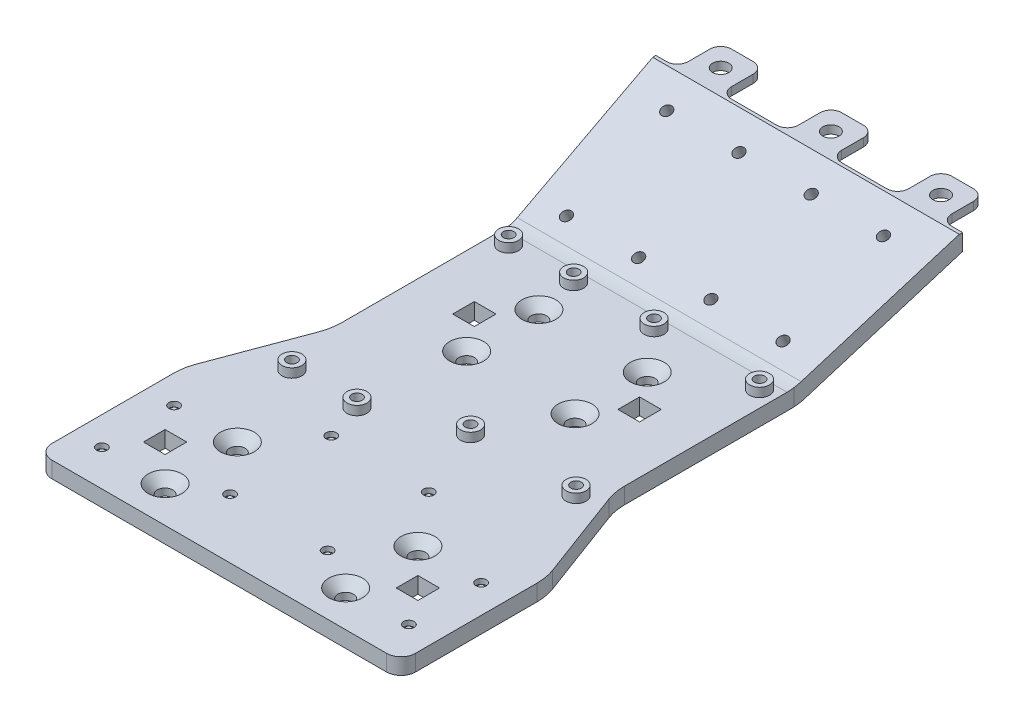
from build123d import *

# Parameters (mm, degrees)
BOSS_EXTRUDE1_DEPTH                            = 2.25
SKETCH5_W                                      = 6
SKETCH5_H                                      = 6
CUT_EXTRUDE1_DEPTH                             = 131.203132163
CSK_FOR_M4_FLAT_HEAD_MACHINE_SCREW1_AT_2_COUNT = 2
CSK_FOR_M4_FLAT_HEAD_MACHINE_SCREW1_AT_2_PITCH = 30
CSK_FOR_M4_FLAT_HEAD_MACHINE_SCREW1_AT_3_COUNT = 2
CSK_FOR_M4_FLAT_HEAD_MACHINE_SCREW1_AT_3_PITCH = 36.055512755
CSK_FOR_M4_FLAT_HEAD_MACHINE_SCREW1_AT_4_COUNT = 2
CSK_FOR_M4_FLAT_HEAD_MACHINE_SCREW1_AT_4_PITCH = 20
CSK_FOR_M4_FLAT_HEAD_MACHINE_SCREW1_AT_5_COUNT = 2
CSK_FOR_M4_FLAT_HEAD_MACHINE_SCREW1_AT_5_PITCH = 101.696853442
CSK_FOR_M4_FLAT_HEAD_MACHINE_SCREW1_AT_6_COUNT = 2
CSK_FOR_M4_FLAT_HEAD_MACHINE_SCREW1_AT_6_PITCH = 74.177152817
CSK_FOR_M4_FLAT_HEAD_MACHINE_SCREW1_AT_7_COUNT = 2
CSK_FOR_M4_FLAT_HEAD_MACHINE_SCREW1_AT_7_PITCH = 94.033238804
CSK_FOR_M4_FLAT_HEAD_MACHINE_SCREW1_AT_8_COUNT = 2
CSK_FOR_M4_FLAT_HEAD_MACHINE_SCREW1_AT_8_PITCH = 83.679447895
FILLET2_R                                      = 4
FILLET3_R                                      = 15
BOSS_EXTRUDE2_DEPTH                            = 42.5
CUT_EXTRUDE5_DEPTH                             = 132.938794996
FILLET5_R                                      = 10
SKETCH22_W                                     = 12
SKETCH22_H                                     = 12
BOSS_EXTRUDE3_DEPTH                            = 2.25
FILLET6_R                                      = 3
M4_CLEARANCE_HOLE1_D                           = 4.5
M2_5_CLEARANCE_HOLE2_D                         = 2.9
SKETCH31_R                                     = 2.75
BOSS_EXTRUDE4_DEPTH                            = 2.5
M2_5_CLEARANCE_HOLE3_D                         = 2.9
SKETCH34_W                                     = 5.7048
SKETCH34_H                                     = 5.7048
CUT_EXTRUDE6_DEPTH                             = 0.85


with BuildPart() as part:
    # Sketch1 → Boss-Extrude1 (new, symmetric)
    with BuildSketch(Plane(origin=(0, 0, 0), x_dir=(1, 0, 0), z_dir=(0, 1, 0))):
        Polygon((-39.17, 0), (39.17, 0), (39.17, -49.7), (50.325, -79.6), (50.325, -120), (-50.325, -120), (-50.325, -79.6), (-39.17, -49.7), align=None)
    extrude(amount=BOSS_EXTRUDE1_DEPTH, both=True)

    # Sketch5 → Cut-Extrude1 (cut, through all)
    with BuildSketch(Plane(origin=(0, 2.25, 0), x_dir=(1, 0, 0), z_dir=(0, 1, 0))):
        with Locations((-22.875, -26.5)):
            Rectangle(SKETCH5_W, SKETCH5_H)
        with Locations((22.875, -26.5)):
            Rectangle(SKETCH5_W, SKETCH5_H)
        with Locations((-35, -100)):
            Rectangle(SKETCH5_W, SKETCH5_H)
        with Locations((35, -100)):
            Rectangle(SKETCH5_W, SKETCH5_H)
    extrude(amount=-CUT_EXTRUDE1_DEPTH, mode=Mode.SUBTRACT)

    # Sketch7 → CSK for M4 Flat Head Machine Screw1 (revolve, cut)
    with BuildSketch(Plane(origin=(15, 2.25, 16.5), x_dir=(0, 0, 1), z_dir=(1, 0, 0))):
        Polygon((0, 0), (0, 4.5), (2.15, 4.5), (2.15, 2.55), (4.7, 0), align=None)
    csk_for_m4_flat_head_machine_screw1 = revolve(axis=Axis((15, 8.6, 16.5), (0, -1, 0)), mode=Mode.SUBTRACT)

    # CSK for M4 Flat Head Machine Screw1 at 2: CSK for M4 Flat Head Machine Screw1 ×2
    with Locations(*[(-i * CSK_FOR_M4_FLAT_HEAD_MACHINE_SCREW1_AT_2_PITCH, 0, 0) for i in range(1, CSK_FOR_M4_FLAT_HEAD_MACHINE_SCREW1_AT_2_COUNT)]):
        add(csk_for_m4_flat_head_machine_screw1, mode=Mode.SUBTRACT)

    # CSK for M4 Flat Head Machine Screw1 at 3: CSK for M4 Flat Head Machine Screw1 ×2
    with Locations(*[Vector(-0.8320502943378516, 0, 0.5547001962252174) * (i * CSK_FOR_M4_FLAT_HEAD_MACHINE_SCREW1_AT_3_PITCH) for i in range(1, CSK_FOR_M4_FLAT_HEAD_MACHINE_SCREW1_AT_3_COUNT)]):
        add(csk_for_m4_flat_head_machine_screw1, mode=Mode.SUBTRACT)

    # CSK for M4 Flat Head Machine Screw1 at 4: CSK for M4 Flat Head Machine Screw1 ×2
    with Locations(*[(0, 0, i * CSK_FOR_M4_FLAT_HEAD_MACHINE_SCREW1_AT_4_PITCH) for i in range(1, CSK_FOR_M4_FLAT_HEAD_MACHINE_SCREW1_AT_4_COUNT)]):
        add(csk_for_m4_flat_head_machine_screw1, mode=Mode.SUBTRACT)

    # CSK for M4 Flat Head Machine Screw1 at 5: CSK for M4 Flat Head Machine Screw1 ×2
    with Locations(*[Vector(-0.3933258369967201, 0, 0.9193991439798221) * (i * CSK_FOR_M4_FLAT_HEAD_MACHINE_SCREW1_AT_5_PITCH) for i in range(1, CSK_FOR_M4_FLAT_HEAD_MACHINE_SCREW1_AT_5_COUNT)]):
        add(csk_for_m4_flat_head_machine_screw1, mode=Mode.SUBTRACT)

    # CSK for M4 Flat Head Machine Screw1 at 6: CSK for M4 Flat Head Machine Screw1 ×2
    with Locations(*[Vector(0.13481240004861683, 0, 0.9908711403573786) * (i * CSK_FOR_M4_FLAT_HEAD_MACHINE_SCREW1_AT_6_PITCH) for i in range(1, CSK_FOR_M4_FLAT_HEAD_MACHINE_SCREW1_AT_6_COUNT)]):
        add(csk_for_m4_flat_head_machine_screw1, mode=Mode.SUBTRACT)

    # CSK for M4 Flat Head Machine Screw1 at 7: CSK for M4 Flat Head Machine Screw1 ×2
    with Locations(*[Vector(0.10634537454172283, 0, 0.9943292519651531) * (i * CSK_FOR_M4_FLAT_HEAD_MACHINE_SCREW1_AT_7_PITCH) for i in range(1, CSK_FOR_M4_FLAT_HEAD_MACHINE_SCREW1_AT_7_COUNT)]):
        add(csk_for_m4_flat_head_machine_screw1, mode=Mode.SUBTRACT)

    # CSK for M4 Flat Head Machine Screw1 at 8: CSK for M4 Flat Head Machine Screw1 ×2
    with Locations(*[Vector(-0.4780146261269101, 0, 0.8783518755081874) * (i * CSK_FOR_M4_FLAT_HEAD_MACHINE_SCREW1_AT_8_PITCH) for i in range(1, CSK_FOR_M4_FLAT_HEAD_MACHINE_SCREW1_AT_8_COUNT)]):
        add(csk_for_m4_flat_head_machine_screw1, mode=Mode.SUBTRACT)

    # Fillet2
    fillet2_edges = [part.edges().sort_by_distance(p)[0] for p in [
        (-50.325, 0, 120),
        (50.325, 0, 120),
    ]]
    fillet(fillet2_edges, radius=FILLET2_R)

    # Fillet3
    fillet3_edges = [part.edges().sort_by_distance(p)[0] for p in [
        (50.325, 0, 79.6),
        (39.17, 0, 49.7),
        (-50.325, 0, 79.6),
        (-39.17, 0, 49.7),
    ]]
    fillet(fillet3_edges, radius=FILLET3_R)

    # Sketch18 → Boss-Extrude2 (add, symmetric)
    with BuildSketch(Plane(origin=(0, 0, 0), x_dir=(0, 0, -1), z_dir=(1, 0, 0))):
        Polygon((0, 2.25), (42.458406944, 19.55), (43.34, 19.55), (43.34, 15.05), (0.881593056, -2.25), (0, -2.25), align=None)
    extrude(amount=BOSS_EXTRUDE2_DEPTH, both=True)

    # Sketch21 → Cut-Extrude5 (cut, through all)
    with BuildSketch(Plane.XZ.offset(2.25)):
        Polygon((39.17, 0), (42.5, -43.34), (42.5, 0), align=None)
        Polygon((-42.5, 0), (-39.17, 0), (-42.5, -43.34), align=None)
    extrude(amount=-CUT_EXTRUDE5_DEPTH, mode=Mode.SUBTRACT)

    # Fillet5
    fillet5_edges = [part.edges().sort_by_distance(p)[0] for p in [
        (0, 2.25, 0),
    ]]
    fillet(fillet5_edges, radius=FILLET5_R)
    fillet5_2_edges = [part.edges().sort_by_distance(p)[0] for p in [
        (0, -2.25, -0.881593056),
    ]]
    fillet(fillet5_2_edges, radius=FILLET5_R)

    # Sketch22 → Boss-Extrude3 (add)
    with BuildSketch(Plane(origin=(0, 19.55, 0), x_dir=(1, 0, 0), z_dir=(0, 1, 0))):
        with Locations((-30.5, 49.34)):
            Rectangle(SKETCH22_W, SKETCH22_H)
        with Locations((0, 49.34)):
            Rectangle(SKETCH22_W, SKETCH22_H)
        with Locations((30.5, 49.34)):
            Rectangle(SKETCH22_W, SKETCH22_H)
    extrude(amount=-BOSS_EXTRUDE3_DEPTH)

    # Fillet6
    fillet6_edges = [part.edges().sort_by_distance(p)[0] for p in [
        (-36.5, 18.425, -55.34),
        (-36.5, 18.425, -43.34),
        (-24.5, 18.425, -55.34),
        (-24.5, 18.425, -43.34),
        (-6, 18.425, -43.34),
        (-6, 18.425, -55.34),
        (6, 18.425, -55.34),
        (6, 18.425, -43.34),
        (24.5, 18.425, -43.34),
        (36.5, 18.425, -43.34),
        (36.5, 18.425, -55.34),
        (24.5, 18.425, -55.34),
    ]]
    fillet(fillet6_edges, radius=FILLET6_R)

    # M4 Clearance Hole1 (through all)
    with Locations(Plane(origin=(0, 19.55, 0), x_dir=(1, 0, 0), z_dir=(0, 1, 0))):
        with Locations((30.5, 49.34), (0, 49.34), (-30.5, 49.34)):
            Hole(M4_CLEARANCE_HOLE1_D / 2)

    # M2.5 Clearance Hole2 (through all)
    with Locations(Plane(origin=(0, 1.929638213, 0.786245728), x_dir=(1, 0, 0), z_dir=(0, 0.9260761220178166, 0.377336741158931))):
        with Locations((29.17, 38.34832507), (9.17, 38.34832507), (-10.83, 38.34832507), (-30.83, 38.34832507), (29.17, 8.34832507), (9.17, 8.34832507), (-10.83, 8.34832507), (-30.83, 8.34832507)):
            Hole(M2_5_CLEARANCE_HOLE2_D / 2)

    # Sketch31 → Boss-Extrude4 (add)
    with BuildSketch(Plane(origin=(0, 2.25, 0), x_dir=(1, 0, 0), z_dir=(0, 1, 0))):
        with Locations((34.725, -5.134095681)):
            Circle(SKETCH31_R)
        with Locations((5.515, -5.134095681)):
            Circle(SKETCH31_R)
        with Locations((5.515, -55.934095681)):
            Circle(SKETCH31_R)
        with Locations((34.725, -55.934095681)):
            Circle(SKETCH31_R)
        with Locations((-16.67, -5.209095681)):
            Circle(SKETCH31_R)
        with Locations((-34.67, -5.209095681)):
            Circle(SKETCH31_R)
        with Locations((-34.67, -65.209095681)):
            Circle(SKETCH31_R)
        with Locations((-16.67, -65.209095681)):
            Circle(SKETCH31_R)
    extrude(amount=BOSS_EXTRUDE4_DEPTH)

    # M2.5 Clearance Hole3 (through all)
    with Locations(Plane(origin=(0, 4.75, 0), x_dir=(1, 0, 0), z_dir=(0, 1, 0))):
        with Locations((34.725, -5.134095681), (34.725, -55.934095681), (5.515, -55.934095681), (5.515, -5.134095681), (-16.67, -5.209095681), (-16.67, -65.209095681), (-34.67, -65.209095681), (-34.67, -5.209095681), (13.5, -75.5), (-13.5, -103.5), (13.5, -103.5), (-13.5, -75.5), (-42.5, -90), (-42.5, -110), (42.5, -90), (42.5, -110)):
            Hole(M2_5_CLEARANCE_HOLE3_D / 2)

    # Sketch34 → Cut-Extrude6 (cut, symmetric)
    with BuildSketch(Plane(origin=(0, 0, 0), x_dir=(1, 0, 0), z_dir=(0, 1, 0))):
        with Locations((34.725, -5.134095681)):
            Rectangle(SKETCH34_W, SKETCH34_H)
        with Locations((34.725, -55.934095681)):
            Rectangle(SKETCH34_W, SKETCH34_H)
        with Locations((5.515, -55.934095681)):
            Rectangle(SKETCH34_W, SKETCH34_H)
        with Locations((5.515, -5.134095681)):
            Rectangle(SKETCH34_W, SKETCH34_H)
        with Locations((-16.67, -5.209095681)):
            Rectangle(SKETCH34_W, SKETCH34_H)
        with Locations((-34.67, -5.209095681)):
            Rectangle(SKETCH34_W, SKETCH34_H)
        with Locations((-16.67, -65.209095681)):
            Rectangle(SKETCH34_W, SKETCH34_H)
        with Locations((-34.67, -65.209095681)):
            Rectangle(SKETCH34_W, SKETCH34_H)
        with Locations((13.5, -75.5)):
            Rectangle(SKETCH34_W, SKETCH34_H)
        with Locations((13.5, -103.5)):
            Rectangle(SKETCH34_W, SKETCH34_H)
        with Locations((-13.5, -75.5)):
            Rectangle(SKETCH34_W, SKETCH34_H)
        with Locations((-13.5, -103.5)):
            Rectangle(SKETCH34_W, SKETCH34_H)
        with Locations((42.5, -90)):
            Rectangle(SKETCH34_W, SKETCH34_H)
        with Locations((42.5, -110)):
            Rectangle(SKETCH34_W, SKETCH34_H)
        with Locations((-42.5, -90)):
            Rectangle(SKETCH34_W, SKETCH34_H)
        with Locations((-42.5, -110)):
            Rectangle(SKETCH34_W, SKETCH34_H)
    extrude(amount=CUT_EXTRUDE6_DEPTH, both=True, mode=Mode.SUBTRACT)


solid = part.part
